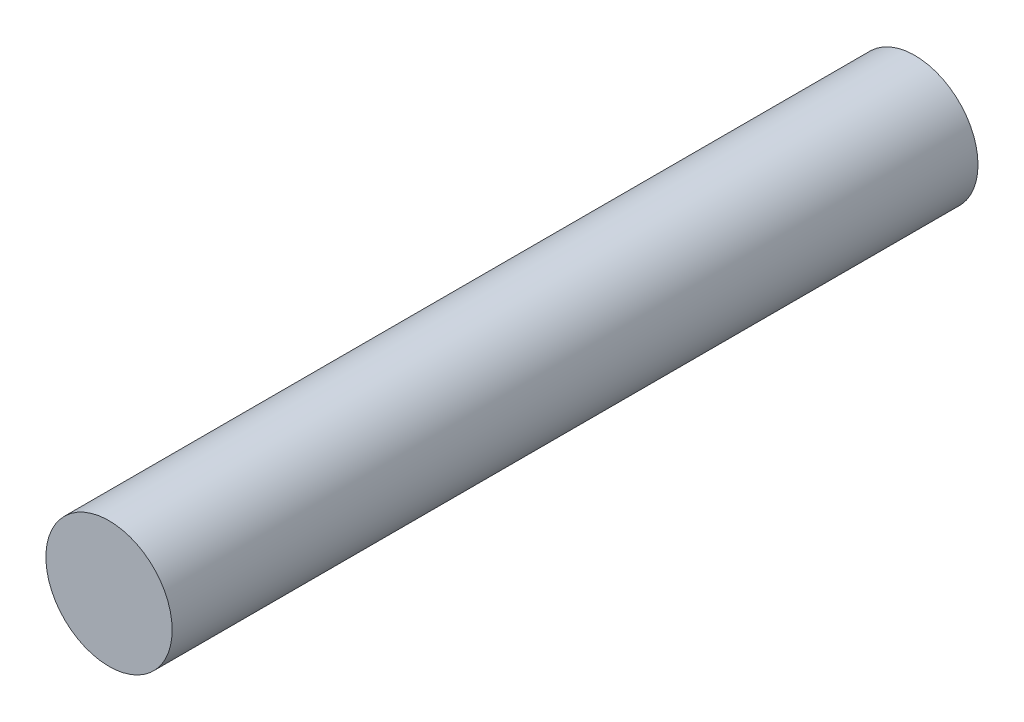
from build123d import *

# Parameters (mm, degrees)
SKETCH1_R           = 3.15
BOSS_EXTRUDE1_DEPTH = 40.2


with BuildPart() as part:
    # Sketch1 → Boss-Extrude1 (new body)
    with BuildSketch(Plane.XY):
        with Locations((-23.972717512, -13.578911998)):
            Circle(SKETCH1_R)
    extrude(amount=BOSS_EXTRUDE1_DEPTH)


solid = part.part
